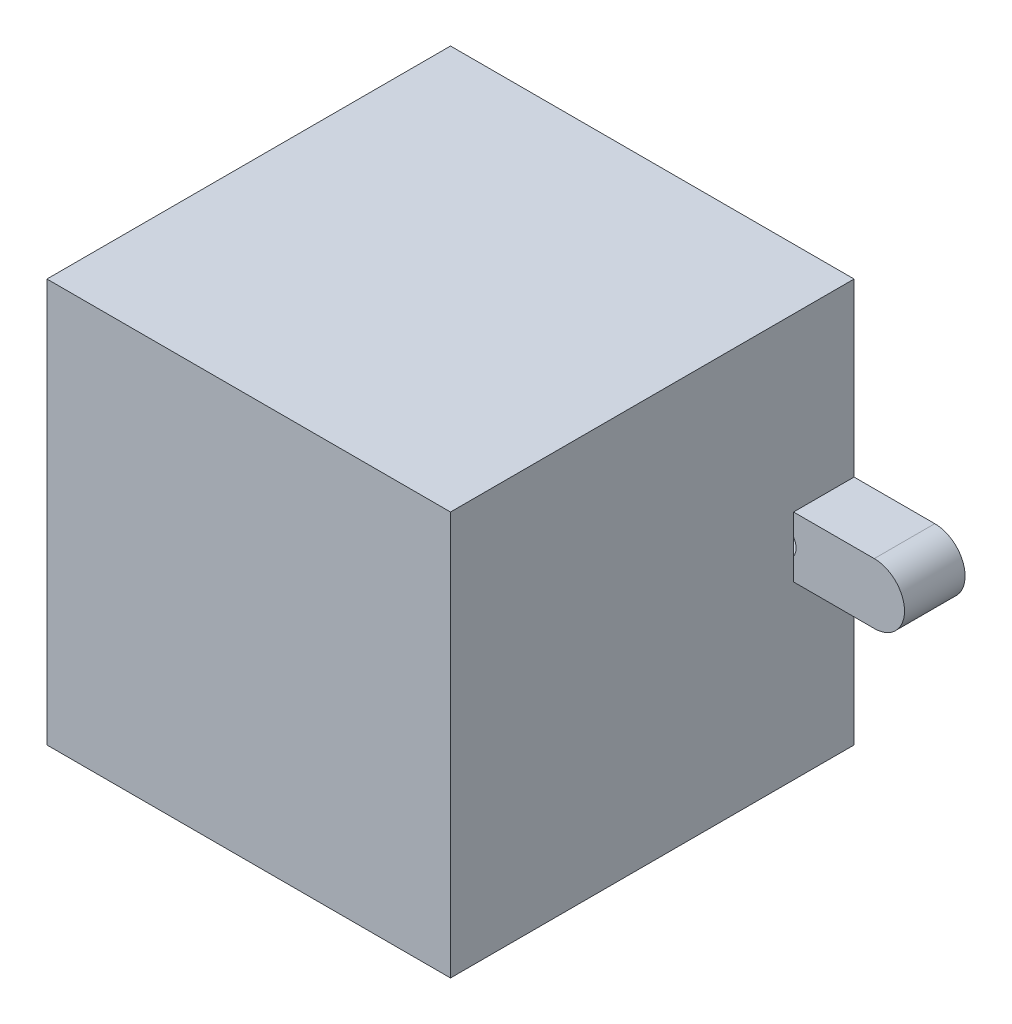
from build123d import *

# Parameters (mm, degrees)
SKETCH1_W               = 40
SKETCH1_H               = 40
BOSS_EXTRUDE1_DEPTH     = 40
SKETCH2_W               = 27
SKETCH2_H               = 27
CUT_EXTRUDE1_DEPTH      = 39
SKETCH3_W               = 11
SKETCH3_H               = 6
BOSS_EXTRUDE3_DEPTH     = 6
SKETCH6_W               = 10.5
SKETCH6_H               = 4
CUT_EXTRUDE2_DEPTH      = 4
SKETCH7_W               = 10.5
SKETCH7_H               = 4
CUT_EXTRUDE3_DEPTH      = 4
SKETCH9_R               = 1.5
CUT_EXTRUDE4_DEPTH      = 2
CUT_EXTRUDE5_DEPTH      = 1
CUT_EXTRUDE5_DEPTH_BACK = 2
SKETCH10_R              = 1.5
FILLET3_RADIUS          = 3
FILLET3_LENGTH          = 6
FILLET4_R               = 2
FILLET6_RADIUS          = 3
FILLET6_LENGTH          = 6
FILLET7_R               = 2


with BuildPart() as part:
    # Sketch1 → Boss-Extrude1 (new body)
    with BuildSketch(Plane.XY):
        Rectangle(SKETCH1_W, SKETCH1_H)
    extrude(amount=BOSS_EXTRUDE1_DEPTH)

    # Sketch2 → Cut-Extrude1 (cut)
    with BuildSketch(Plane(origin=(0, 0, 0), x_dir=(-1, 0, 0), z_dir=(0, 0, -1))):
        Rectangle(SKETCH2_W, SKETCH2_H)
    extrude(amount=-CUT_EXTRUDE1_DEPTH, mode=Mode.SUBTRACT)

    # Sketch3 → Boss-Extrude3 (add)
    with BuildSketch(Plane(origin=(0, 0, 0), x_dir=(-1, 0, 0), z_dir=(0, 0, -1))):
        Polygon((-20, 0), (-20, 3), (-31, 3), (-31, 0), (-31, -3), (-20, -3), align=None)
        with Locations((25.5, 0)):
            Rectangle(SKETCH3_W, SKETCH3_H)
    extrude(amount=-BOSS_EXTRUDE3_DEPTH)

    # Sketch6 → Cut-Extrude2 (cut)
    with BuildSketch(Plane(origin=(0, 0, 0), x_dir=(-1, 0, 0), z_dir=(0, 0, -1))):
        with Locations((-18.75, 0.029439605)):
            Rectangle(SKETCH6_W, SKETCH6_H)
    extrude(amount=-CUT_EXTRUDE2_DEPTH, mode=Mode.SUBTRACT)

    # Sketch7 → Cut-Extrude3 (cut)
    with BuildSketch(Plane(origin=(0, 0, 0), x_dir=(-1, 0, 0), z_dir=(0, 0, -1))):
        with Locations((18.75, -0.052667078)):
            Rectangle(SKETCH7_W, SKETCH7_H)
    extrude(amount=-CUT_EXTRUDE3_DEPTH, mode=Mode.SUBTRACT)

    # Sketch9 → Cut-Extrude4 (cut)
    with BuildSketch(Plane(origin=(0, 0, 4), x_dir=(-1, 0, 0), z_dir=(0, 0, -1))):
        with Locations((-18.75, 0.029439605)):
            Circle(SKETCH9_R)
    extrude(amount=-CUT_EXTRUDE4_DEPTH, mode=Mode.SUBTRACT)

    # Sketch10 → Cut-Extrude5 (cut, two sides: drawn at the far end of the back side and taken through both)
    with BuildSketch(Plane(origin=(0, 0, 4), x_dir=(-1, 0, 0), z_dir=(0, 0, -1)).offset(-CUT_EXTRUDE5_DEPTH_BACK)):
        with Locations(Location((18.75, -0.052667078, 0), (0, 0, 33.557309762))):
            Circle(SKETCH10_R)
    extrude(amount=CUT_EXTRUDE5_DEPTH + CUT_EXTRUDE5_DEPTH_BACK, mode=Mode.SUBTRACT)

    # Fillet3: full round fillet: the end face becomes a half cylinder, R = half its width
    fillet3_face = Plane((31, 0, 3), x_dir=(0, 0, -1), z_dir=(1, 0, 0))  # on the end face: x along it, z out of the body
    fillet3_slab = fillet3_face.offset(-FILLET3_RADIUS / 2) * Box(FILLET3_LENGTH, 2 * FILLET3_RADIUS, FILLET3_RADIUS, mode=Mode.PRIVATE)  # the body's end, R deep
    fillet3_round = Plane((28, 0, 3), x_dir=(1, 0, 0), z_dir=(0, 0, -1)) * Cylinder(FILLET3_RADIUS, FILLET3_LENGTH, mode=Mode.PRIVATE)  # its axis R under the face
    add(fillet3_slab - fillet3_round, mode=Mode.SUBTRACT)

    # Fillet4
    fillet4_edges = [part.edges().sort_by_distance(p)[0] for p in [
        (24, -1.970560395, 2),
        (24, 2.029439605, 2),
    ]]
    fillet(fillet4_edges, radius=FILLET4_R - 0.0001)  # a hair under: the kernel refuses the full size

    # Fillet6: full round fillet: the end face becomes a half cylinder, R = half its width
    fillet6_face = Plane((-31, 0, 3), x_dir=(0, 0, -1), z_dir=(-1, 0, 0))  # on the end face: x along it, z out of the body
    fillet6_slab = fillet6_face.offset(-FILLET6_RADIUS / 2) * Box(FILLET6_LENGTH, 2 * FILLET6_RADIUS, FILLET6_RADIUS, mode=Mode.PRIVATE)  # the body's end, R deep
    fillet6_round = Plane((-28, 0, 3), x_dir=(-1, 0, 0), z_dir=(0, 0, -1)) * Cylinder(FILLET6_RADIUS, FILLET6_LENGTH, mode=Mode.PRIVATE)  # its axis R under the face
    add(fillet6_slab - fillet6_round, mode=Mode.SUBTRACT)

    # Fillet7
    fillet7_edges = [part.edges().sort_by_distance(p)[0] for p in [
        (-24, 1.947332922, 2),
        (-24, -2.052667078, 2),
    ]]
    fillet(fillet7_edges, radius=FILLET7_R - 0.0001)  # a hair under: the kernel refuses the full size


solid = part.part
